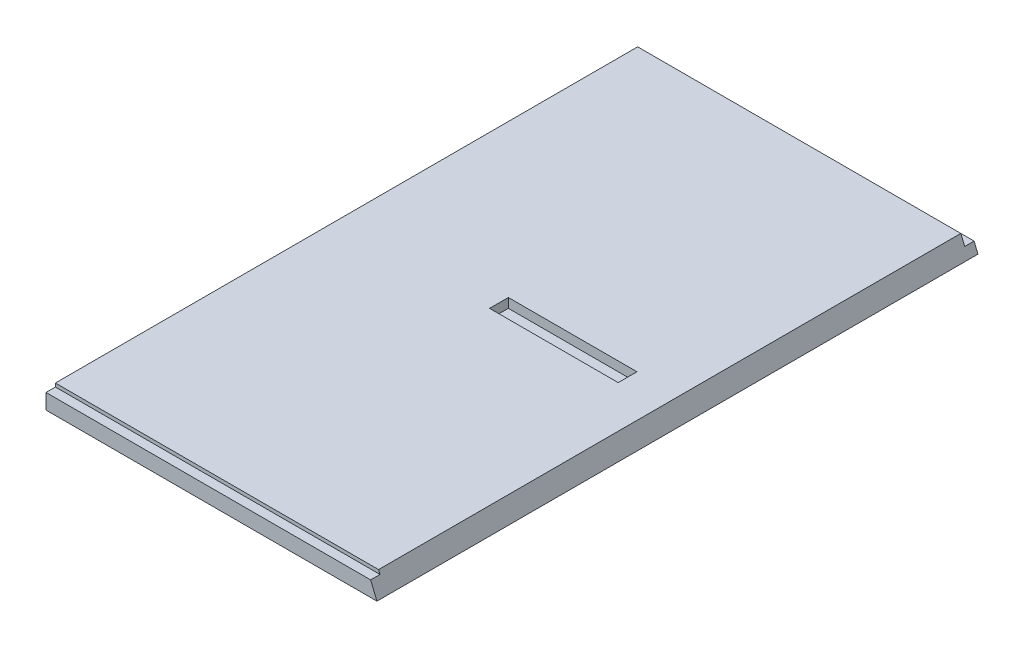
from build123d import *

# Parameters (mm, degrees)
BOSS_EXTRUDE1_DEPTH = 406.4
SKETCH2_W           = 223.774
SKETCH2_H           = 6.35
CUT_EXTRUDE1_DEPTH  = 2.3622
CAVITY1_START       = 196.85
CAVITY1_OUTLINE_W   = 86.97620095
CAVITY1_OUTLINE_H   = 6.35
CAVITY1_DEPTH       = 12.7
SKETCH3_W           = 266.782886341
SKETCH3_H           = 6.35
CUT_EXTRUDE2_DEPTH  = 6.35


# Read off the part's stored shape, not the designer's step: Cavity1
with BuildPart() as part:
    # Sketch1 → Boss-Extrude1 (new body)
    with BuildSketch(Plane.XY):
        Polygon((0, 0), (0, 12.7), (218.513487758, 12.7), (223.774, 0), align=None)
    extrude(amount=BOSS_EXTRUDE1_DEPTH)

    # Sketch2 → Cut-Extrude1 (cut)
    with BuildSketch(Plane.XZ.offset(-12.7)):
        with Locations((111.887, 403.225)):
            Rectangle(SKETCH2_W, SKETCH2_H)
    extrude(amount=CUT_EXTRUDE1_DEPTH, mode=Mode.SUBTRACT)

    # Cavity1 outline → Cavity1 (cut)
    with BuildSketch(Plane.XY.offset(CAVITY1_START)):
        with Locations((146.563552259, 9.525)):
            Rectangle(CAVITY1_OUTLINE_W, CAVITY1_OUTLINE_H)
    extrude(amount=CAVITY1_DEPTH, mode=Mode.SUBTRACT)

    # Sketch3 → Cut-Extrude2 (cut)
    with BuildSketch(Plane(origin=(0, 12.7, 0), x_dir=(1, 0, 0), z_dir=(0, 1, 0))):
        with Locations((133.39144317, -3.175)):
            Rectangle(SKETCH3_W, SKETCH3_H)
    extrude(amount=-CUT_EXTRUDE2_DEPTH, mode=Mode.SUBTRACT)


solid = part.part
